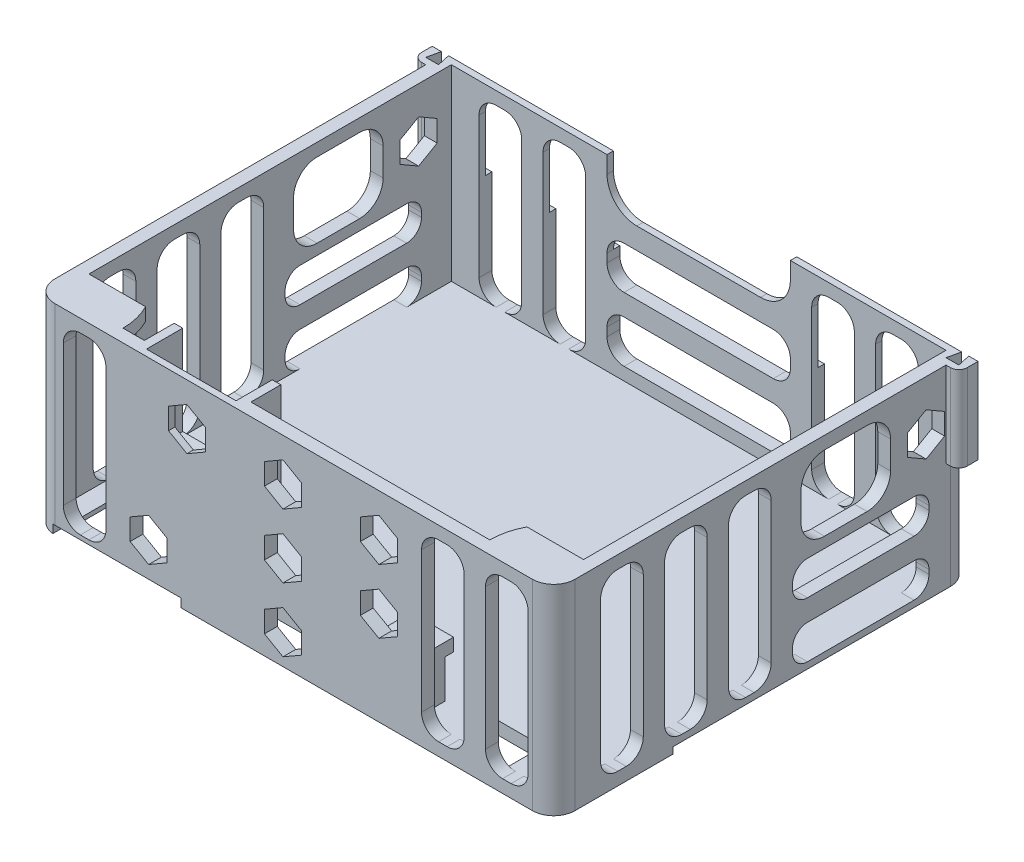
from build123d import *

# Parameters (mm, degrees)
SKETCH1_W                = 61
SKETCH1_H                = 49
BOSS_EXTRUDE1_DEPTH      = 23.5
SKETCH2_W                = 58
SKETCH2_H                = 46
CUT_EXTRUDE1_DEPTH       = 22
SKETCH3_W                = 16
SKETCH3_H                = 3
SKETCH3_W_2              = 5.2
SKETCH3_H_2              = 4.15
SKETCH3_W_3              = 12
SKETCH3_H_3              = 5
CUT_EXTRUDE2_DEPTH       = 1.5
SKETCH4_W                = 21.5
SKETCH4_H                = 1.5
CUT_EXTRUDE3_DEPTH       = 5.5
SKETCH5_W                = 10.5
SKETCH5_H                = 8.75
CUT_EXTRUDE6_DEPTH       = 61
SKETCH8_W                = 5
SKETCH8_H                = 3
BOSS_EXTRUDE2_DEPTH      = 6
SKETCH9_W                = 5
SKETCH9_H                = 1.5
BOSS_EXTRUDE3_DEPTH      = 1
SKETCH10_W               = 10.5
SKETCH10_H               = 10.5
CUT_EXTRUDE8_DEPTH       = 0.75
BOSS_EXTRUDE4_DEPTH      = 3.5
SKETCH12_W               = 7.5
SKETCH12_H               = 7.5
BOSS_EXTRUDE5_DEPTH      = 1.5
FILLET1_R                = 2.75
FILLET2_R                = 2.75
FILLET3_R                = 2.75
FILLET4_R                = 2.75
FILLET5_R                = 3.5
FILLET6_R                = 3.5
FILLET7_R                = 7.5
FILLET8_R                = 7.5
FILLET9_R                = 2.5
FILLET10_R               = 2.5
FILLET11_R               = 2.5
FILLET12_R               = 2.5
CUT_EXTRUDE10_DEPTH      = 61
FILLET13_R               = 2.75
FILLET14_R               = 2.75
FILLET15_R               = 2.75
FILLET16_R               = 2.75
CUT_EXTRUDE11_DEPTH      = 61
CUT_EXTRUDE12_DEPTH      = 1.5
CUT_EXTRUDE14_DEPTH      = 61
CUT_EXTRUDE15_DEPTH      = 1.5
CUT_EXTRUDE18_DEPTH      = 1.5
CUT_EXTRUDE18_DEPTH_BACK = 1.5
CUT_EXTRUDE19_DEPTH      = 1.5
BOSS_EXTRUDE6_DEPTH      = 10
BOSS_EXTRUDE7_DEPTH      = 10
CUT_EXTRUDE23_DEPTH      = 10
SKETCH31_W               = 3
SKETCH31_H               = 3
BOSS_EXTRUDE9_DEPTH      = 10
CUT_EXTRUDE24_DEPTH      = 10
SKETCH33_W               = 64
SKETCH33_H               = 0.75
CUT_EXTRUDE25_DEPTH      = 10
FILLET17_R               = 1
FILLET18_R               = 1
SKETCH35_W               = 1.5
SKETCH35_H               = 1.5
CUT_EXTRUDE27_DEPTH      = 1
SKETCH38_W               = 58
SKETCH38_H               = 4
CUT_EXTRUDE29_DEPTH      = 1.5
SKETCH40_W               = 15.02
SKETCH40_H               = 8.01
CUT_EXTRUDE31_DEPTH      = 1
CUT_EXTRUDE32_START      = -0.75
SKETCH41_W               = 57
SKETCH41_H               = 34.5
CUT_EXTRUDE32_DEPTH      = 0.75


with BuildPart() as part:
    # Sketch1 → Boss-Extrude1 (new body)
    with BuildSketch(Plane(origin=(0, 0, 0), x_dir=(1, 0, 0), z_dir=(0, 1, 0))):
        with Locations((-50.798701292, -19.282823978)):
            Rectangle(SKETCH1_W, SKETCH1_H)
    extrude(amount=BOSS_EXTRUDE1_DEPTH)

    # Sketch2 → Cut-Extrude1 (cut)
    with BuildSketch(Plane(origin=(0, 23.5, 0), x_dir=(1, 0, 0), z_dir=(0, 1, 0))):
        with Locations((-50.798701292, -19.282823978)):
            Rectangle(SKETCH2_W, SKETCH2_H)
    extrude(amount=-CUT_EXTRUDE1_DEPTH, mode=Mode.SUBTRACT)

    # Sketch3 → Cut-Extrude2 (cut)
    with BuildSketch(Plane(origin=(0, 1.5, 0), x_dir=(1, 0, 0), z_dir=(0, 1, 0))):
        with Locations((-50.538701292, -40.782823978)):
            Rectangle(SKETCH3_W, SKETCH3_H)
        with Locations((-29.798701292, -40.207823978)):
            Rectangle(SKETCH3_W_2, SKETCH3_H_2)
        with Locations((-71.538701292, -39.782823978)):
            Rectangle(SKETCH3_W_3, SKETCH3_H_3)
    extrude(amount=-CUT_EXTRUDE2_DEPTH, mode=Mode.SUBTRACT)

    # Sketch4 → Cut-Extrude3 (cut)
    with BuildSketch(Plane(origin=(0, 23.5, 0), x_dir=(1, 0, 0), z_dir=(0, 1, 0))):
        with Locations((-50.798701292, 4.467176022)):
            Rectangle(SKETCH4_W, SKETCH4_H)
    extrude(amount=-CUT_EXTRUDE3_DEPTH, mode=Mode.SUBTRACT)

    # Sketch5 → Cut-Extrude6 (cut)
    with BuildSketch(Plane.ZY.offset(81.298701292)):
        with Locations((9.532823978, 17.625)):
            Rectangle(SKETCH5_W, SKETCH5_H)
    extrude(amount=-CUT_EXTRUDE6_DEPTH, mode=Mode.SUBTRACT)

    # Sketch8 → Boss-Extrude2 (add)
    with BuildSketch(Plane(origin=(0, 1.5, 0), x_dir=(1, 0, 0), z_dir=(0, 1, 0))):
        with Locations((-40.038701292, -40.782823978)):
            Rectangle(SKETCH8_W, SKETCH8_H)
        with Locations((-61.038701292, -40.782823978)):
            Rectangle(SKETCH8_W, SKETCH8_H)
    extrude(amount=BOSS_EXTRUDE2_DEPTH)

    # Sketch9 → Boss-Extrude3 (add)
    with BuildSketch(Plane(origin=(0, 0, 39.282823978), x_dir=(-1, 0, 0), z_dir=(0, 0, -1))):
        with Locations((40.038701292, 6.75)):
            Rectangle(SKETCH9_W, SKETCH9_H)
        with Locations((61.038701292, 6.75)):
            Rectangle(SKETCH9_W, SKETCH9_H)
    extrude(amount=BOSS_EXTRUDE3_DEPTH)

    # Sketch10 → Cut-Extrude8 (cut)
    with BuildSketch(Plane(origin=(0, 0, 42.282823978), x_dir=(-1, 0, 0), z_dir=(0, 0, -1))):
        with Locations((63.548701292, 18.25)):
            Rectangle(SKETCH10_W, SKETCH10_H)
    extrude(amount=-CUT_EXTRUDE8_DEPTH, mode=Mode.SUBTRACT)

    # Sketch11 → Boss-Extrude4 (add)
    with BuildSketch(Plane(origin=(0, 0, 42.282823978), x_dir=(-1, 0, 0), z_dir=(0, 0, -1))):
        Polygon((58.298701292, 13), (58.298701292, 23.5), (57.298701292, 23.5), (57.298701292, 12), (69.798701292, 12), (69.798701292, 23.5), (68.798701292, 23.5), (68.798701292, 13), align=None)
    extrude(amount=BOSS_EXTRUDE4_DEPTH)

    # Sketch12 → Boss-Extrude5 (add)
    with BuildSketch(Plane(origin=(0, 23.5, 0), x_dir=(1, 0, 0), z_dir=(0, 1, 0))):
        with Locations((-25.548701292, -38.532823978)):
            Rectangle(SKETCH12_W, SKETCH12_H)
        with Locations((-76.048701292, -38.532823978)):
            Rectangle(SKETCH12_W, SKETCH12_H)
    extrude(amount=-BOSS_EXTRUDE5_DEPTH)

    # Fillet1
    fillet1_edges = [part.edges().sort_by_distance(p)[0] for p in [
        (-80.548701292, 13.25, 14.782823978),
    ]]
    fillet(fillet1_edges, radius=FILLET1_R)

    # Fillet2
    fillet2_edges = [part.edges().sort_by_distance(p)[0] for p in [
        (-80.548701292, 22, 14.782823978),
    ]]
    fillet(fillet2_edges, radius=FILLET2_R)

    # Fillet3
    fillet3_edges = [part.edges().sort_by_distance(p)[0] for p in [
        (-80.548701292, 22, 4.282823978),
    ]]
    fillet(fillet3_edges, radius=FILLET3_R)

    # Fillet4
    fillet4_edges = [part.edges().sort_by_distance(p)[0] for p in [
        (-80.548701292, 13.25, 4.282823978),
    ]]
    fillet(fillet4_edges, radius=FILLET4_R)

    # Fillet5
    fillet5_edges = [part.edges().sort_by_distance(p)[0] for p in [
        (-40.048701292, 18, -4.467176022),
    ]]
    fillet(fillet5_edges, radius=FILLET5_R)

    # Fillet6
    fillet6_edges = [part.edges().sort_by_distance(p)[0] for p in [
        (-61.548701292, 18, -4.467176022),
    ]]
    fillet(fillet6_edges, radius=FILLET6_R)

    # Fillet7
    fillet7_edges = [part.edges().sort_by_distance(p)[0] for p in [
        (-29.298701292, 22.75, 34.782823978),
    ]]
    fillet(fillet7_edges, radius=FILLET7_R - 0.0001)  # a hair under: the kernel refuses the full size

    # Fillet8
    fillet8_edges = [part.edges().sort_by_distance(p)[0] for p in [
        (-72.298701292, 22.75, 34.782823978),
    ]]
    fillet(fillet8_edges, radius=FILLET8_R - 0.0001)  # a hair under: the kernel refuses the full size

    # Fillet9
    fillet9_edges = [part.edges().sort_by_distance(p)[0] for p in [
        (-20.298701292, 11.75, -5.217176022),
    ]]
    fillet(fillet9_edges, radius=FILLET9_R)

    # Fillet10
    fillet10_edges = [part.edges().sort_by_distance(p)[0] for p in [
        (-81.298701292, 11.75, -5.217176022),
    ]]
    fillet(fillet10_edges, radius=FILLET10_R)

    # Fillet11
    fillet11_edges = [part.edges().sort_by_distance(p)[0] for p in [
        (-81.298701292, 11.75, 43.782823978),
    ]]
    fillet(fillet11_edges, radius=FILLET11_R)

    # Fillet12
    fillet12_edges = [part.edges().sort_by_distance(p)[0] for p in [
        (-20.298701292, 11.75, 43.782823978),
    ]]
    fillet(fillet12_edges, radius=FILLET12_R)

    # Sketch13 → Cut-Extrude10 (cut)
    with BuildSketch(Plane(origin=(-20.298701292, 0, 0), x_dir=(0, 0, -1), z_dir=(1, 0, 0))):
        with BuildLine():
            Line((-36.282823978, 22), (-35.282823978, 22))
            ThreePointArc((-35.282823978, 22), (-33.868610415, 21.414213562), (-33.282823978, 20))
            Line((-33.282823978, 20), (-33.282823978, 3.5))
            ThreePointArc((-33.282823978, 3.5), (-33.868610415, 2.085786438), (-35.282823978, 1.5))
            Line((-35.282823978, 1.5), (-36.282823978, 1.5))
            ThreePointArc((-36.282823978, 1.5), (-37.69703754, 2.085786438), (-38.282823978, 3.5))
            Line((-38.282823978, 3.5), (-38.282823978, 20))
            ThreePointArc((-38.282823978, 20), (-37.69703754, 21.414213562), (-36.282823978, 22))
        make_face()
        with BuildLine():
            Line((-28.782823978, 22), (-27.782823978, 22))
            ThreePointArc((-27.782823978, 22), (-26.368610415, 21.414213562), (-25.782823978, 20))
            Line((-25.782823978, 20), (-25.782823978, 3.5))
            ThreePointArc((-25.782823978, 3.5), (-26.368610415, 2.085786438), (-27.782823978, 1.5))
            Line((-27.782823978, 1.5), (-28.782823978, 1.5))
            ThreePointArc((-28.782823978, 1.5), (-30.19703754, 2.085786438), (-30.782823978, 3.5))
            Line((-30.782823978, 3.5), (-30.782823978, 20))
            ThreePointArc((-30.782823978, 20), (-30.19703754, 21.414213562), (-28.782823978, 22))
        make_face()
        with BuildLine():
            Line((-21.282823978, 22), (-20.282823978, 22))
            ThreePointArc((-20.282823978, 22), (-18.868610415, 21.414213562), (-18.282823978, 20))
            Line((-18.282823978, 20), (-18.282823978, 3.5))
            ThreePointArc((-18.282823978, 3.5), (-18.868610415, 2.085786438), (-20.282823978, 1.5))
            Line((-20.282823978, 1.5), (-21.282823978, 1.5))
            ThreePointArc((-21.282823978, 1.5), (-22.69703754, 2.085786438), (-23.282823978, 3.5))
            Line((-23.282823978, 3.5), (-23.282823978, 20))
            ThreePointArc((-23.282823978, 20), (-22.69703754, 21.414213562), (-21.282823978, 22))
        make_face()
    extrude(amount=-CUT_EXTRUDE10_DEPTH, mode=Mode.SUBTRACT)

    # Fillet13
    fillet13_edges = [part.edges().sort_by_distance(p)[0] for p in [
        (-21.048701292, 13.25, 14.782823978),
    ]]
    fillet(fillet13_edges, radius=FILLET13_R)

    # Fillet14
    fillet14_edges = [part.edges().sort_by_distance(p)[0] for p in [
        (-21.048701292, 22, 14.782823978),
    ]]
    fillet(fillet14_edges, radius=FILLET14_R)

    # Fillet15
    fillet15_edges = [part.edges().sort_by_distance(p)[0] for p in [
        (-21.048701292, 13.25, 4.282823978),
    ]]
    fillet(fillet15_edges, radius=FILLET15_R)

    # Fillet16
    fillet16_edges = [part.edges().sort_by_distance(p)[0] for p in [
        (-21.048701292, 22, 4.282823978),
    ]]
    fillet(fillet16_edges, radius=FILLET16_R)

    # Sketch16 → Cut-Extrude11 (cut)
    with BuildSketch(Plane(origin=(-20.298701292, 0, 0), x_dir=(0, 0, -1), z_dir=(1, 0, 0))):
        Polygon((-0.117760468, 20.125), (-2.282823978, 18.875), (-2.282823978, 16.375), (-0.117760468, 15.125), (2.047303041, 16.375), (2.047303041, 18.875), align=None)
    extrude(amount=-CUT_EXTRUDE11_DEPTH, mode=Mode.SUBTRACT)

    # Sketch19 → Cut-Extrude12 (cut)
    with BuildSketch(Plane(origin=(0, 0, -5.217176022), x_dir=(-1, 0, 0), z_dir=(0, 0, -1))):
        with BuildLine():
            Line((66.048701292, 22), (67.048701292, 22))
            ThreePointArc((67.048701292, 22), (68.462914854, 21.414213562), (69.048701292, 20))
            Line((69.048701292, 20), (69.048701292, 3.5))
            ThreePointArc((69.048701292, 3.5), (68.462914854, 2.085786438), (67.048701292, 1.5))
            Line((67.048701292, 1.5), (66.048701292, 1.5))
            ThreePointArc((66.048701292, 1.5), (64.634487729, 2.085786438), (64.048701292, 3.5))
            Line((64.048701292, 3.5), (64.048701292, 20))
            ThreePointArc((64.048701292, 20), (64.634487729, 21.414213562), (66.048701292, 22))
        make_face()
        with BuildLine():
            Line((73.548701292, 22), (74.548701292, 22))
            ThreePointArc((74.548701292, 22), (75.962914854, 21.414213562), (76.548701292, 20))
            Line((76.548701292, 20), (76.548701292, 3.5))
            ThreePointArc((76.548701292, 3.5), (75.962914854, 2.085786438), (74.548701292, 1.5))
            Line((74.548701292, 1.5), (73.548701292, 1.5))
            ThreePointArc((73.548701292, 1.5), (72.134487729, 2.085786438), (71.548701292, 3.5))
            Line((71.548701292, 3.5), (71.548701292, 20))
            ThreePointArc((71.548701292, 20), (72.134487729, 21.414213562), (73.548701292, 22))
        make_face()
        with BuildLine():
            Line((27.048701292, 22), (28.048701292, 22))
            ThreePointArc((28.048701292, 22), (29.462914854, 21.414213562), (30.048701292, 20))
            Line((30.048701292, 20), (30.048701292, 3.5))
            ThreePointArc((30.048701292, 3.5), (29.462914854, 2.085786438), (28.048701292, 1.5))
            Line((28.048701292, 1.5), (27.048701292, 1.5))
            ThreePointArc((27.048701292, 1.5), (25.634487729, 2.085786438), (25.048701292, 3.5))
            Line((25.048701292, 3.5), (25.048701292, 20))
            ThreePointArc((25.048701292, 20), (25.634487729, 21.414213562), (27.048701292, 22))
        make_face()
        with BuildLine():
            Line((34.548701292, 22), (35.548701292, 22))
            ThreePointArc((35.548701292, 22), (36.962914854, 21.414213562), (37.548701292, 20))
            Line((37.548701292, 20), (37.548701292, 3.5))
            ThreePointArc((37.548701292, 3.5), (36.962914854, 2.085786438), (35.548701292, 1.5))
            Line((35.548701292, 1.5), (34.548701292, 1.5))
            ThreePointArc((34.548701292, 1.5), (33.134487729, 2.085786438), (32.548701292, 3.5))
            Line((32.548701292, 3.5), (32.548701292, 20))
            ThreePointArc((32.548701292, 20), (33.134487729, 21.414213562), (34.548701292, 22))
        make_face()
        with BuildLine():
            Line((42.048701292, 15.5), (59.548701292, 15.5))
            ThreePointArc((59.548701292, 15.5), (60.962914854, 14.914213562), (61.548701292, 13.5))
            Line((61.548701292, 13.5), (61.548701292, 12.5))
            ThreePointArc((61.548701292, 12.5), (60.962914854, 11.085786438), (59.548701292, 10.5))
            Line((59.548701292, 10.5), (42.048701292, 10.5))
            ThreePointArc((42.048701292, 10.5), (40.634487729, 11.085786438), (40.048701292, 12.5))
            Line((40.048701292, 12.5), (40.048701292, 13.5))
            ThreePointArc((40.048701292, 13.5), (40.634487729, 14.914213562), (42.048701292, 15.5))
        make_face()
        with BuildLine():
            Line((42.048701292, 8), (59.548701292, 8))
            ThreePointArc((59.548701292, 8), (60.962914854, 7.414213562), (61.548701292, 6))
            Line((61.548701292, 6), (61.548701292, 5))
            ThreePointArc((61.548701292, 5), (60.962914854, 3.585786438), (59.548701292, 3))
            Line((59.548701292, 3), (42.048701292, 3))
            ThreePointArc((42.048701292, 3), (40.634487729, 3.585786438), (40.048701292, 5))
            Line((40.048701292, 5), (40.048701292, 6))
            ThreePointArc((40.048701292, 6), (40.634487729, 7.414213562), (42.048701292, 8))
        make_face()
    extrude(amount=-CUT_EXTRUDE12_DEPTH, mode=Mode.SUBTRACT)

    # Sketch20 → Cut-Extrude14 (cut)
    with BuildSketch(Plane(origin=(-20.298701292, 0, 0), x_dir=(0, 0, -1), z_dir=(1, 0, 0))):
        with BuildLine():
            Line((-1.532823978, 1.5), (-14.032823978, 1.5))
            ThreePointArc((-14.032823978, 1.5), (-15.270260845, 2.012563133), (-15.782823978, 3.25))
            Line((-15.782823978, 3.25), (-15.782823978, 3.75))
            ThreePointArc((-15.782823978, 3.75), (-15.270260845, 4.987436867), (-14.032823978, 5.5))
            Line((-14.032823978, 5.5), (-1.532823978, 5.5))
            ThreePointArc((-1.532823978, 5.5), (-0.295387111, 4.987436867), (0.217176022, 3.75))
            Line((0.217176022, 3.75), (0.217176022, 3.25))
            ThreePointArc((0.217176022, 3.25), (-0.295387111, 2.012563133), (-1.532823978, 1.5))
        make_face()
        with BuildLine():
            Line((-1.532823978, 8), (-14.032823978, 8))
            ThreePointArc((-14.032823978, 8), (-15.270260845, 8.512563133), (-15.782823978, 9.75))
            Line((-15.782823978, 9.75), (-15.782823978, 10.25))
            ThreePointArc((-15.782823978, 10.25), (-15.270260845, 11.487436867), (-14.032823978, 12))
            Line((-14.032823978, 12), (-1.532823978, 12))
            ThreePointArc((-1.532823978, 12), (-0.295387111, 11.487436867), (0.217176022, 10.25))
            Line((0.217176022, 10.25), (0.217176022, 9.75))
            ThreePointArc((0.217176022, 9.75), (-0.295387111, 8.512563133), (-1.532823978, 8))
        make_face()
    extrude(amount=-CUT_EXTRUDE14_DEPTH, mode=Mode.SUBTRACT)

    # Sketch22 → Cut-Extrude15 (cut)
    with BuildSketch(Plane(origin=(0, 0, 42.282823978), x_dir=(-1, 0, 0), z_dir=(0, 0, -1))):
        with BuildLine():
            Line((75.798701292, 22), (74.798701292, 22))
            ThreePointArc((74.798701292, 22), (73.384487729, 21.414213562), (72.798701292, 20))
            Line((72.798701292, 20), (72.798701292, 3.5))
            ThreePointArc((72.798701292, 3.5), (73.384487729, 2.085786438), (74.798701292, 1.5))
            Line((74.798701292, 1.5), (75.798701292, 1.5))
            ThreePointArc((75.798701292, 1.5), (77.212914854, 2.085786438), (77.798701292, 3.5))
            Line((77.798701292, 3.5), (77.798701292, 20))
            ThreePointArc((77.798701292, 20), (77.212914854, 21.414213562), (75.798701292, 22))
        make_face()
        with BuildLine():
            Line((26.298701292, 22), (25.298701292, 22))
            ThreePointArc((25.298701292, 22), (23.884487729, 21.414213562), (23.298701292, 20))
            Line((23.298701292, 20), (23.298701292, 3.5))
            ThreePointArc((23.298701292, 3.5), (23.884487729, 2.085786438), (25.298701292, 1.5))
            Line((25.298701292, 1.5), (26.298701292, 1.5))
            ThreePointArc((26.298701292, 1.5), (27.712914854, 2.085786438), (28.298701292, 3.5))
            Line((28.298701292, 3.5), (28.298701292, 20))
            ThreePointArc((28.298701292, 20), (27.712914854, 21.414213562), (26.298701292, 22))
        make_face()
        with BuildLine():
            Line((33.798701292, 22), (32.798701292, 22))
            ThreePointArc((32.798701292, 22), (31.384487729, 21.414213562), (30.798701292, 20))
            Line((30.798701292, 20), (30.798701292, 3.5))
            ThreePointArc((30.798701292, 3.5), (31.384487729, 2.085786438), (32.798701292, 1.5))
            Line((32.798701292, 1.5), (33.798701292, 1.5))
            ThreePointArc((33.798701292, 1.5), (35.212914854, 2.085786438), (35.798701292, 3.5))
            Line((35.798701292, 3.5), (35.798701292, 20))
            ThreePointArc((35.798701292, 20), (35.212914854, 21.414213562), (33.798701292, 22))
        make_face()
    extrude(amount=-CUT_EXTRUDE15_DEPTH, mode=Mode.SUBTRACT)

    # Sketch23 → Cut-Extrude18 (cut, two sides: drawn at the far end of the back side and taken through both)
    with BuildSketch(Plane(origin=(0, 0, 43.032823978), x_dir=(-1, 0, 0), z_dir=(0, 0, -1)).offset(-CUT_EXTRUDE18_DEPTH_BACK)):
        Polygon((40.798701292, 16), (42.963764801, 17.25), (42.963764801, 19.75), (40.798701292, 21), (38.633637782, 19.75), (38.633637782, 17.25), align=None)
        Polygon((52.048701292, 16), (54.213764801, 17.25), (54.213764801, 19.75), (52.048701292, 21), (49.883637782, 19.75), (49.883637782, 17.25), align=None)
        Polygon((63.298701292, 16), (65.463764801, 17.25), (65.463764801, 19.75), (63.298701292, 21), (61.133637782, 19.75), (61.133637782, 17.25), align=None)
        Polygon((52.048701292, 8.5), (54.213764801, 9.75), (54.213764801, 12.25), (52.048701292, 13.5), (49.883637782, 12.25), (49.883637782, 9.75), align=None)
        Polygon((52.048701292, 1), (54.213764801, 2.25), (54.213764801, 4.75), (52.048701292, 6), (49.883637782, 4.75), (49.883637782, 2.25), align=None)
        Polygon((40.798701292, 8.5), (42.963764801, 9.75), (42.963764801, 12.25), (40.798701292, 13.5), (38.633637782, 12.25), (38.633637782, 9.75), align=None)
    extrude(amount=CUT_EXTRUDE18_DEPTH + CUT_EXTRUDE18_DEPTH_BACK, mode=Mode.SUBTRACT)

    # Sketch24 → Cut-Extrude19 (cut)
    with BuildSketch(Plane(origin=(0, 0, 42.282823978), x_dir=(-1, 0, 0), z_dir=(0, 0, -1))):
        Polygon((67.798701292, 7.5), (65.633637782, 6.25), (65.633637782, 3.75), (67.798701292, 2.5), (69.963764801, 3.75), (69.963764801, 6.25), align=None)
    extrude(amount=-CUT_EXTRUDE19_DEPTH, mode=Mode.SUBTRACT)

    # Sketch25 → Boss-Extrude6 (add)
    with BuildSketch(Plane(origin=(0, 23.5, 0), x_dir=(1, 0, 0), z_dir=(0, 1, 0))):
        with BuildLine():
            Line((-20.298701292, 2.717176022), (-20.298701292, 5.217176022))
            Line((-20.298701292, 5.217176022), (-22.798701292, 5.217176022))
            ThreePointArc((-22.798701292, 5.217176022), (-21.030934339, 4.484942975), (-20.298701292, 2.717176022))
        make_face()
        with BuildLine():
            Line((-81.298701292, 5.217176022), (-78.798701292, 5.217176022))
            ThreePointArc((-78.798701292, 5.217176022), (-80.566468245, 4.484942975), (-81.298701292, 2.717176022))
            Line((-81.298701292, 2.717176022), (-81.298701292, 5.217176022))
        make_face()
    extrude(amount=-BOSS_EXTRUDE6_DEPTH)

    # Sketch27 → Boss-Extrude7 (add)
    with BuildSketch(Plane(origin=(0, 23.5, 0), x_dir=(1, 0, 0), z_dir=(0, 1, 0))):
        Polygon((-20.298701292, 5.217176022), (-20.298701292, 3.717176022), (-20.298701292, 2.217176022), (-18.798701292, 2.217176022), (-18.798701292, 5.217176022), align=None)
    extrude(amount=-BOSS_EXTRUDE7_DEPTH)

    # Sketch28 → Cut-Extrude23 (cut)
    with BuildSketch(Plane(origin=(0, 23.5, 0), x_dir=(1, 0, 0), z_dir=(0, 1, 0))):
        Polygon((-20.048701292, 5.217176022), (-19.548701292, 2.967176022), (-21.048701292, 2.967176022), (-20.548701292, 5.217176022), align=None)
    extrude(amount=-CUT_EXTRUDE23_DEPTH, mode=Mode.SUBTRACT)

    # Sketch31 → Boss-Extrude9 (add)
    with BuildSketch(Plane(origin=(0, 23.5, 0), x_dir=(1, 0, 0), z_dir=(0, 1, 0))):
        with Locations((-81.298701292, 3.717176022)):
            Rectangle(SKETCH31_W, SKETCH31_H)
    extrude(amount=-BOSS_EXTRUDE9_DEPTH)

    # Sketch32 → Cut-Extrude24 (cut)
    with BuildSketch(Plane(origin=(0, 23.5, 0), x_dir=(1, 0, 0), z_dir=(0, 1, 0))):
        Polygon((-81.048701292, 5.217176022), (-80.548701292, 2.967176022), (-82.048701292, 2.967176022), (-81.548701292, 5.217176022), align=None)
    extrude(amount=-CUT_EXTRUDE24_DEPTH, mode=Mode.SUBTRACT)

    # Sketch33 → Cut-Extrude25 (cut)
    with BuildSketch(Plane(origin=(0, 23.5, 0), x_dir=(1, 0, 0), z_dir=(0, 1, 0))):
        with Locations((-50.798701292, 4.842176022)):
            Rectangle(SKETCH33_W, SKETCH33_H)
    extrude(amount=-CUT_EXTRUDE25_DEPTH, mode=Mode.SUBTRACT)

    # Fillet17
    fillet17_edges = [part.edges().sort_by_distance(p)[0] for p in [
        (-82.798701292, 18.5, -2.217176022),
    ]]
    fillet(fillet17_edges, radius=FILLET17_R)

    # Fillet18
    fillet18_edges = [part.edges().sort_by_distance(p)[0] for p in [
        (-18.798701292, 18.5, -2.217176022),
    ]]
    fillet(fillet18_edges, radius=FILLET18_R)

    # Sketch35 → Cut-Extrude27 (cut)
    with BuildSketch(Plane(origin=(0, 0, 0), x_dir=(-1, 0, 0), z_dir=(0, -1, 0))):
        with Locations((64.778701292, -36.522823978)):
            Rectangle(SKETCH35_W, SKETCH35_H)
        with Locations((71.538701292, -36.532823978)):
            Rectangle(SKETCH35_W, SKETCH35_H)
        with Locations((78.298701292, -43.042823978)):
            Rectangle(SKETCH35_W, SKETCH35_H)
        with Locations((71.538701292, -43.032823978)):
            Rectangle(SKETCH35_W, SKETCH35_H)
        with Locations((64.778701292, -43.042823978)):
            Rectangle(SKETCH35_W, SKETCH35_H)
        with Locations((78.298701292, -36.522823978)):
            Rectangle(SKETCH35_W, SKETCH35_H)
    extrude(amount=-CUT_EXTRUDE27_DEPTH, mode=Mode.SUBTRACT)

    # Sketch38 → Cut-Extrude29 (cut)
    with BuildSketch(Plane(origin=(0, 23.5, 0), x_dir=(1, 0, 0), z_dir=(0, 1, 0))):
        with Locations((-50.798701292, -36.782823978)):
            Rectangle(SKETCH38_W, SKETCH38_H)
    extrude(amount=-CUT_EXTRUDE29_DEPTH, mode=Mode.SUBTRACT)

    # Sketch40 → Cut-Extrude31 (cut)
    with BuildSketch(Plane(origin=(0, 0, 0), x_dir=(-1, 0, 0), z_dir=(0, -1, 0))):
        with Locations((71.538701292, -39.777823978)):
            Rectangle(SKETCH40_W, SKETCH40_H)
    extrude(amount=-CUT_EXTRUDE31_DEPTH, mode=Mode.SUBTRACT)

    # Sketch41 → Cut-Extrude32 (cut)
    with BuildSketch(Plane(origin=(0, 0, 0), x_dir=(-1, 0, 0), z_dir=(0, -1, 0)).offset(CUT_EXTRUDE32_START)):
        with BuildLine():
            Line((22.798701292, -32.282823978), (78.798701292, -32.282823978))
            ThreePointArc((78.798701292, -32.282823978), (80.566468245, -31.550590931), (81.298701292, -29.782823978))
            Line((81.298701292, -29.782823978), (81.298701292, 2.717176022))
            ThreePointArc((81.298701292, 2.717176022), (80.566468245, 4.484942975), (78.798701292, 5.217176022))
            Line((78.798701292, 5.217176022), (22.798701292, 5.217176022))
            ThreePointArc((22.798701292, 5.217176022), (21.030934339, 4.484942975), (20.298701292, 2.717176022))
            Line((20.298701292, 2.717176022), (20.298701292, -29.782823978))
            ThreePointArc((20.298701292, -29.782823978), (21.030934339, -31.550590931), (22.798701292, -32.282823978))
        make_face()
        with Locations((50.798701292, -13.532823978)):
            Rectangle(SKETCH41_W, SKETCH41_H, mode=Mode.SUBTRACT)
    extrude(amount=CUT_EXTRUDE32_DEPTH, mode=Mode.SUBTRACT)


solid = part.part
